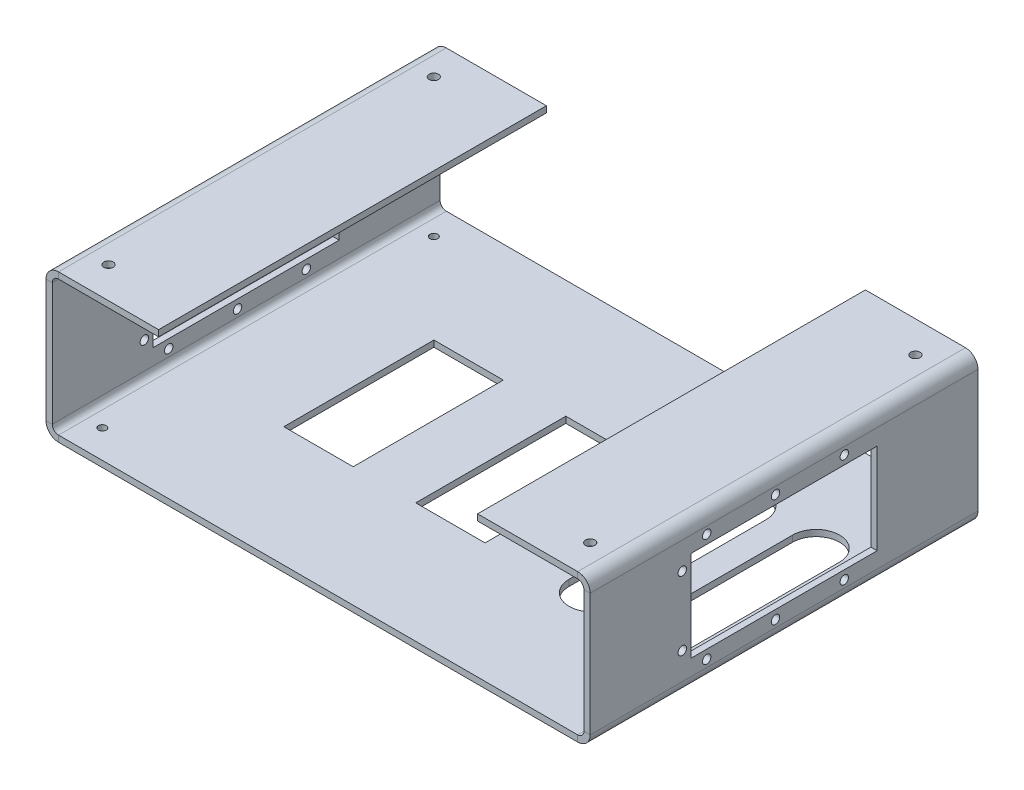
from build123d import *

# Parameters (mm, degrees)
ESBO_O1_W                 = 174
ESBO_O1_H                 = 2
EXTRUS_O_FINA1_DEPTH      = 124
ESBO_O2_R                 = 1.25
CORTE_EXTRUS_O1_DEPTH     = 10
ESBO_O3_W                 = 2
ESBO_O3_H                 = 124
RESSALTO_EXTRUS_O1_DEPTH  = 45.2
ESBO_O4_W                 = 124
ESBO_O4_H                 = 2
RESSALTO_EXTRUS_O2_DEPTH  = 34
ESBO_O5_W                 = 124
ESBO_O5_H                 = 2
RESSALTO_EXTRUS_O3_DEPTH  = 34
CORTE_EXTRUS_O2_REACH     = 220.392
ESBO_O6_R                 = 1.35
ESBO_O6_W                 = 59.5
ESBO_O6_H                 = 29
ESBO_O7_R                 = 1.5
CORTE_EXTRUS_O3_DEPTH     = 2
ESBO_O8_W                 = 22.175
ESBO_O8_H                 = 48
CORTE_EXTRUS_O4_DEPTH     = 2
CONVERTER_S_LIDO1_DEPTH   = 124
CONVERTER_S_LIDO1_2_DEPTH = 124


# Read off the part's stored shape, not the designer's step: Converter-Sólido1
with BuildPart() as part:
    # Esboço1 → Extrusão-Fina1 (new body)
    with BuildSketch(Plane.XY):
        with Locations((13.061802497, -1)):
            Rectangle(ESBO_O1_W, ESBO_O1_H)
    extrude(amount=EXTRUS_O_FINA1_DEPTH)

    # Esboço2 → Corte-extrusão1 (cut)
    with BuildSketch(Plane(origin=(0, 0, 0), x_dir=(1, 0, 0), z_dir=(0, 1, 0))):
        with Locations(Location((-64.938197503, -9, 0), (0, 0, 270))):
            Circle(ESBO_O2_R)
        with Locations(Location((-64.938197503, -115, 0), (0, 0, 270))):
            Circle(ESBO_O2_R)
        with Locations(Location((91.061802497, -115, 0), (0, 0, 270))):
            Circle(ESBO_O2_R)
        with Locations(Location((91.061802497, -9, 0), (0, 0, 270))):
            Circle(ESBO_O2_R)
    extrude(amount=-CORTE_EXTRUS_O1_DEPTH, mode=Mode.SUBTRACT)

    # Esboço3 → Ressalto-extrusão1 (add)
    with BuildSketch(Plane(origin=(0, 0, 0), x_dir=(1, 0, 0), z_dir=(0, 1, 0))):
        with Locations((-72.938197503, -62)):
            Rectangle(ESBO_O3_W, ESBO_O3_H)
        with Locations((99.061802497, -62)):
            Rectangle(ESBO_O3_W, ESBO_O3_H)
    extrude(amount=RESSALTO_EXTRUS_O1_DEPTH)

    # Esboço4 → Ressalto-extrusão2 (add)
    with BuildSketch(Plane(origin=(-71.938197503, 0, 0), x_dir=(0, 0, -1), z_dir=(1, 0, 0))):
        with Locations((-62, 44.2)):
            Rectangle(ESBO_O4_W, ESBO_O4_H)
    extrude(amount=RESSALTO_EXTRUS_O2_DEPTH)

    # Esboço5 → Ressalto-extrusão3 (add)
    with BuildSketch(Plane.ZY.offset(-98.061802497)):
        with Locations((62, 44.2)):
            Rectangle(ESBO_O5_W, ESBO_O5_H)
    extrude(amount=RESSALTO_EXTRUS_O3_DEPTH)

    # Esboço6 → Corte-extrusão2 (cut, up to next)
    with BuildSketch(Plane(origin=(100.061802497, 0, 0), x_dir=(0, 0, -1), z_dir=(1, 0, 0)), mode=Mode.PRIVATE) as corte_extrus_o2_sk1:
        with Locations(Location((-86.75, 38.9, 0), (0, 0, 180))):
            Circle(ESBO_O6_R)
    corte_extrus_o2_tool1 = extrude(corte_extrus_o2_sk1.sketch, amount=-CORTE_EXTRUS_O2_REACH, mode=Mode.PRIVATE) & part.part
    # Esboço6 → Corte-extrusão2 (cut, up to next)
    with BuildSketch(Plane(origin=(100.061802497, 0, 0), x_dir=(0, 0, -1), z_dir=(1, 0, 0)), mode=Mode.PRIVATE) as corte_extrus_o2_sk2:
        with Locations(Location((-64.75, 38.9, 0), (0, 0, 180))):
            Circle(ESBO_O6_R)
    corte_extrus_o2_tool2 = extrude(corte_extrus_o2_sk2.sketch, amount=-CORTE_EXTRUS_O2_REACH, mode=Mode.PRIVATE) & part.part
    # Esboço6 → Corte-extrusão2 (cut, up to next)
    with BuildSketch(Plane(origin=(100.061802497, 0, 0), x_dir=(0, 0, -1), z_dir=(1, 0, 0)), mode=Mode.PRIVATE) as corte_extrus_o2_sk3:
        with Locations(Location((-42.75, 38.9, 0), (0, 0, 180))):
            Circle(ESBO_O6_R)
    corte_extrus_o2_tool3 = extrude(corte_extrus_o2_sk3.sketch, amount=-CORTE_EXTRUS_O2_REACH, mode=Mode.PRIVATE) & part.part
    # Esboço6 → Corte-extrusão2 (cut, up to next)
    with BuildSketch(Plane(origin=(100.061802497, 0, 0), x_dir=(0, 0, -1), z_dir=(1, 0, 0)), mode=Mode.PRIVATE) as corte_extrus_o2_sk4:
        with Locations(Location((-86.75, 4.3, 0), (0, 0, 180))):
            Circle(ESBO_O6_R)
    corte_extrus_o2_tool4 = extrude(corte_extrus_o2_sk4.sketch, amount=-CORTE_EXTRUS_O2_REACH, mode=Mode.PRIVATE) & part.part
    # Esboço6 → Corte-extrusão2 (cut, up to next)
    with BuildSketch(Plane(origin=(100.061802497, 0, 0), x_dir=(0, 0, -1), z_dir=(1, 0, 0)), mode=Mode.PRIVATE) as corte_extrus_o2_sk5:
        with Locations(Location((-64.75, 4.3, 0), (0, 0, 180))):
            Circle(ESBO_O6_R)
    corte_extrus_o2_tool5 = extrude(corte_extrus_o2_sk5.sketch, amount=-CORTE_EXTRUS_O2_REACH, mode=Mode.PRIVATE) & part.part
    # Esboço6 → Corte-extrusão2 (cut, up to next)
    with BuildSketch(Plane(origin=(100.061802497, 0, 0), x_dir=(0, 0, -1), z_dir=(1, 0, 0)), mode=Mode.PRIVATE) as corte_extrus_o2_sk6:
        with Locations(Location((-42.75, 4.3, 0), (0, 0, 180))):
            Circle(ESBO_O6_R)
    corte_extrus_o2_tool6 = extrude(corte_extrus_o2_sk6.sketch, amount=-CORTE_EXTRUS_O2_REACH, mode=Mode.PRIVATE) & part.part
    # Esboço6 → Corte-extrusão2 (cut, up to next)
    with BuildSketch(Plane(origin=(100.061802497, 0, 0), x_dir=(0, 0, -1), z_dir=(1, 0, 0)), mode=Mode.PRIVATE) as corte_extrus_o2_sk7:
        with Locations(Location((-94.55, 32.6, 0), (0, 0, 180))):
            Circle(ESBO_O6_R)
    corte_extrus_o2_tool7 = extrude(corte_extrus_o2_sk7.sketch, amount=-CORTE_EXTRUS_O2_REACH, mode=Mode.PRIVATE) & part.part
    # Esboço6 → Corte-extrusão2 (cut, up to next)
    with BuildSketch(Plane(origin=(100.061802497, 0, 0), x_dir=(0, 0, -1), z_dir=(1, 0, 0)), mode=Mode.PRIVATE) as corte_extrus_o2_sk8:
        with Locations(Location((-94.55, 10.6, 0), (0, 0, 180))):
            Circle(ESBO_O6_R)
    corte_extrus_o2_tool8 = extrude(corte_extrus_o2_sk8.sketch, amount=-CORTE_EXTRUS_O2_REACH, mode=Mode.PRIVATE) & part.part
    # Esboço6 → Corte-extrusão2 (cut, up to next)
    with BuildSketch(Plane(origin=(100.061802497, 0, 0), x_dir=(0, 0, -1), z_dir=(1, 0, 0)), mode=Mode.PRIVATE) as corte_extrus_o2_sk9:
        with Locations((-62, 21.6)):
            Rectangle(ESBO_O6_W, ESBO_O6_H)
    corte_extrus_o2_tool9 = extrude(corte_extrus_o2_sk9.sketch, amount=-CORTE_EXTRUS_O2_REACH, mode=Mode.PRIVATE) & part.part
    add(corte_extrus_o2_tool1.solids().sort_by_distance((100.061802, 38.9, 86.75))[0], mode=Mode.SUBTRACT)
    add(corte_extrus_o2_tool1.solids().sort_by_distance((100.061802, 38.9, 86.75))[1], mode=Mode.SUBTRACT)
    add(corte_extrus_o2_tool2.solids().sort_by_distance((100.061802, 38.9, 64.75))[0], mode=Mode.SUBTRACT)
    add(corte_extrus_o2_tool2.solids().sort_by_distance((100.061802, 38.9, 64.75))[1], mode=Mode.SUBTRACT)
    add(corte_extrus_o2_tool3.solids().sort_by_distance((100.061802, 38.9, 42.75))[0], mode=Mode.SUBTRACT)
    add(corte_extrus_o2_tool3.solids().sort_by_distance((100.061802, 38.9, 42.75))[1], mode=Mode.SUBTRACT)
    add(corte_extrus_o2_tool4.solids().sort_by_distance((100.061802, 4.3, 86.75))[0], mode=Mode.SUBTRACT)
    add(corte_extrus_o2_tool4.solids().sort_by_distance((100.061802, 4.3, 86.75))[1], mode=Mode.SUBTRACT)
    add(corte_extrus_o2_tool5.solids().sort_by_distance((100.061802, 4.3, 64.75))[0], mode=Mode.SUBTRACT)
    add(corte_extrus_o2_tool5.solids().sort_by_distance((100.061802, 4.3, 64.75))[1], mode=Mode.SUBTRACT)
    add(corte_extrus_o2_tool6.solids().sort_by_distance((100.061802, 4.3, 42.75))[0], mode=Mode.SUBTRACT)
    add(corte_extrus_o2_tool6.solids().sort_by_distance((100.061802, 4.3, 42.75))[1], mode=Mode.SUBTRACT)
    add(corte_extrus_o2_tool7.solids().sort_by_distance((100.061802, 32.6, 94.55))[0], mode=Mode.SUBTRACT)
    add(corte_extrus_o2_tool7.solids().sort_by_distance((100.061802, 32.6, 94.55))[1], mode=Mode.SUBTRACT)
    add(corte_extrus_o2_tool8.solids().sort_by_distance((100.061802, 10.6, 94.55))[0], mode=Mode.SUBTRACT)
    add(corte_extrus_o2_tool8.solids().sort_by_distance((100.061802, 10.6, 94.55))[1], mode=Mode.SUBTRACT)
    add(corte_extrus_o2_tool9.solids().sort_by_distance((100.061802, 21.6, 62))[0], mode=Mode.SUBTRACT)
    add(corte_extrus_o2_tool9.solids().sort_by_distance((100.061802, 21.6, 62))[1], mode=Mode.SUBTRACT)

    # Esboço7 → Corte-extrusão3 (cut)
    with BuildSketch(Plane(origin=(0, 45.2, 0), x_dir=(1, 0, 0), z_dir=(0, 1, 0))):
        with Locations(Location((-63.938197503, -10, 0), (0, 0, 270))):
            Circle(ESBO_O7_R)
        with Locations(Location((90.061802497, -10, 0), (0, 0, 270))):
            Circle(ESBO_O7_R)
        with Locations(Location((90.061802497, -114, 0), (0, 0, 270))):
            Circle(ESBO_O7_R)
        with Locations(Location((-63.938197503, -114, 0), (0, 0, 270))):
            Circle(ESBO_O7_R)
    extrude(amount=-CORTE_EXTRUS_O3_DEPTH, mode=Mode.SUBTRACT)

    # Esboço8 → Corte-extrusão4 (cut)
    with BuildSketch(Plane(origin=(0, 0, 0), x_dir=(1, 0, 0), z_dir=(0, 1, 0))):
        with Locations((-25.155697503, -61.66)):
            Rectangle(ESBO_O8_W, ESBO_O8_H)
        with BuildLine():
            Line((90.106802497, -34.3), (90.106802497, -82.3))
            ThreePointArc((90.106802497, -82.3), (82.606802497, -89.8), (75.106802497, -82.3))
            Line((75.106802497, -82.3), (75.106802497, -34.3))
            ThreePointArc((75.106802497, -34.3), (82.606802497, -26.8), (90.106802497, -34.3))
        make_face()
        with Locations((17.019302497, -61.66)):
            Rectangle(ESBO_O8_W, ESBO_O8_H)
        with BuildLine():
            Line((66.606802497, -34.3), (66.606802497, -82.3))
            ThreePointArc((66.606802497, -82.3), (59.106802497, -89.8), (51.606802497, -82.3))
            Line((51.606802497, -82.3), (51.606802497, -34.3))
            ThreePointArc((51.606802497, -34.3), (59.106802497, -26.8), (66.606802497, -34.3))
        make_face()
    extrude(amount=-CORTE_EXTRUS_O4_DEPTH, mode=Mode.SUBTRACT)

    # Converter-Sólido1 outline → Converter-Sólido1 (cut)
    with BuildSketch(Plane.XY):
        with BuildLine():
            ThreePointArc((96.061802497, 45.2), (98.890229621, 44.028427124), (100.061802497, 41.2))
            Line((100.061802497, 41.2), (100.061802497, 45.2))
            Line((100.061802497, 45.2), (96.061802497, 45.2))
        make_face()
        with BuildLine():
            ThreePointArc((100.061802497, 2), (98.890229621, -0.828427125), (96.061802497, -2))
            Line((96.061802497, -2), (100.061802497, -2))
            Line((100.061802497, -2), (100.061802497, 2))
        make_face()
        with BuildLine():
            ThreePointArc((-69.938197503, -2), (-72.766624628, -0.828427125), (-73.938197503, 2))
            Line((-73.938197503, 2), (-73.938197503, -2))
            Line((-73.938197503, -2), (-69.938197503, -2))
        make_face()
        with BuildLine():
            ThreePointArc((-73.938197503, 41.2), (-72.766624628, 44.028427125), (-69.938197503, 45.2))
            Line((-69.938197503, 45.2), (-73.938197503, 45.2))
            Line((-73.938197503, 45.2), (-73.938197503, 41.2))
        make_face()
    extrude(amount=CONVERTER_S_LIDO1_DEPTH, mode=Mode.SUBTRACT)

    # Converter-S_lido1 2 outline → Converter-S_lido1 2 (add)
    with BuildSketch(Plane.XY):
        with BuildLine():
            ThreePointArc((96.061802497, 43.2), (97.476016059, 42.614213562), (98.061802497, 41.2))
            Line((98.061802497, 41.2), (98.061802497, 43.2))
            Line((98.061802497, 43.2), (96.061802497, 43.2))
        make_face()
        with BuildLine():
            ThreePointArc((98.061802497, 2), (97.476016059, 0.585786438), (96.061802497, 0))
            Line((96.061802497, 0), (98.061802497, 0))
            Line((98.061802497, 0), (98.061802497, 2))
        make_face()
        with BuildLine():
            ThreePointArc((-69.938197503, 0), (-71.352411066, 0.585786437), (-71.938197503, 2))
            Line((-71.938197503, 2), (-71.938197503, 0))
            Line((-71.938197503, 0), (-69.938197503, 0))
        make_face()
        with BuildLine():
            ThreePointArc((-71.938197503, 41.2), (-71.352411066, 42.614213563), (-69.938197503, 43.2))
            Line((-69.938197503, 43.2), (-71.938197503, 43.2))
            Line((-71.938197503, 43.2), (-71.938197503, 41.2))
        make_face()
    extrude(amount=CONVERTER_S_LIDO1_2_DEPTH)


solid = part.part
